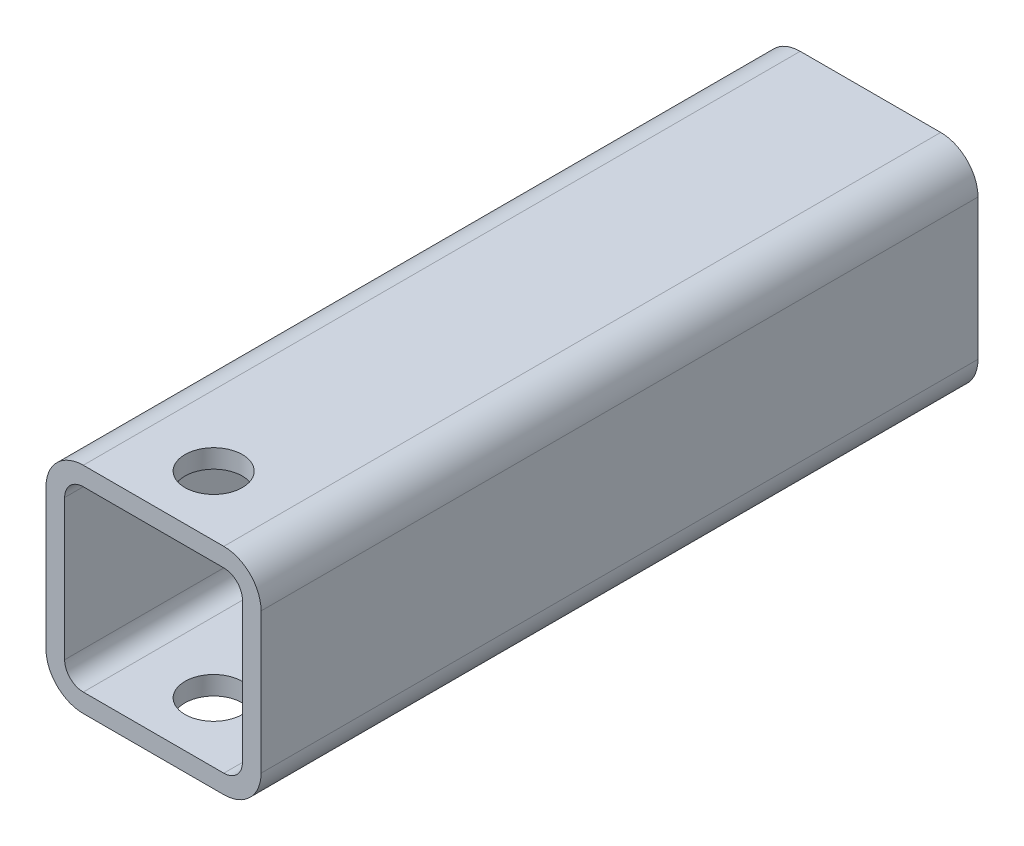
from build123d import *

# Parameters (mm, degrees)
SISTEMA_START              = -68.082035122
SISTEMA_ESTRUCTURAL2_DEPTH = 100
CORTAR_EXTRUIR1_REACH      = 77.896
CROQUIS9_R                 = 4


# Read off the part's stored shape, not the designer's step: Sistema estructural2
with BuildPart() as part:
    # Sistema estructural2 outline → Sistema estructural2 (new body)
    with BuildSketch(Plane.XY.offset(SISTEMA_START)):
        with BuildLine():
            ThreePointArc((15, 9.8), (13.476955262, 13.476955262), (9.8, 15))
            Line((9.8, 15), (-9.8, 15))
            ThreePointArc((-9.8, 15), (-13.476955262, 13.476955262), (-15, 9.8))
            Line((-15, 9.8), (-15, -9.8))
            ThreePointArc((-15, -9.8), (-13.476955262, -13.476955262), (-9.8, -15))
            Line((-9.8, -15), (9.8, -15))
            ThreePointArc((9.8, -15), (13.476955262, -13.476955262), (15, -9.8))
            Line((15, -9.8), (15, 9.8))
        make_face()
        with BuildLine():
            ThreePointArc((12.4, -9.8), (11.638477631, -11.638477631), (9.8, -12.4))
            Line((9.8, -12.4), (-9.8, -12.4))
            ThreePointArc((-9.8, -12.4), (-11.638477631, -11.638477631), (-12.4, -9.8))
            Line((-12.4, -9.8), (-12.4, 9.8))
            ThreePointArc((-12.4, 9.8), (-11.638477631, 11.638477631), (-9.8, 12.4))
            Line((-9.8, 12.4), (9.8, 12.4))
            ThreePointArc((9.8, 12.4), (11.638477631, 11.638477631), (12.4, 9.8))
            Line((12.4, 9.8), (12.4, -9.8))
        make_face(mode=Mode.SUBTRACT)
    extrude(amount=SISTEMA_ESTRUCTURAL2_DEPTH)

    # Cortar-Extruir1: up to this face of the body (flat: up to its plane)
    cortar_extruir1_end = Plane(part.part.faces().sort_by_distance((0, -15, -18.082035122))[0])
    # Croquis9 → Cortar-Extruir1 (cut, up to the picked face)
    with BuildSketch(Plane(origin=(0, 15, 0), x_dir=(1, 0, 0), z_dir=(0, 1, 0)), mode=Mode.PRIVATE) as cortar_extruir1_sk1:
        with Locations(Location((0, -23.532428894, 0), (0, 0, 270))):
            Circle(CROQUIS9_R)
    cortar_extruir1_tool1 = split(extrude(cortar_extruir1_sk1.sketch, amount=-CORTAR_EXTRUIR1_REACH, mode=Mode.PRIVATE), bisect_by=cortar_extruir1_end, keep=Keep.BOTH, mode=Mode.PRIVATE)
    add(cortar_extruir1_tool1.solids().sort_by(Axis((0, 15, 23.532429), (0, -1, 0)))[0], mode=Mode.SUBTRACT)


solid = part.part
